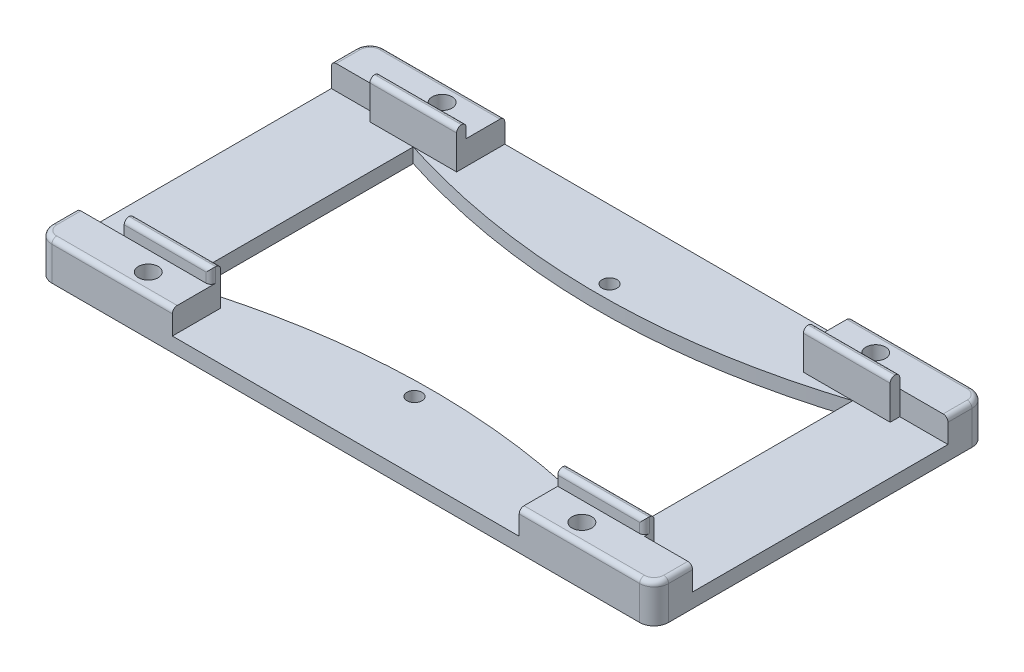
from build123d import *

# Parameters (mm, degrees)
SKETCH1_W                      = 128
SKETCH1_H                      = 69
BOSS_EXTRUDE1_DEPTH            = 3
SKETCH5_R                      = 1.55
CUT_EXTRUDE5_DEPTH             = 10
SKETCH7_W                      = 28
SKETCH7_H                      = 8
BOSS_EXTRUDE2_DEPTH            = 5
SKETCH2_R                      = 2.05
CUT_EXTRUDE6_DEPTH             = 73.878323252
CUT_EXTRUDE6_DIRECTION_2_REACH = 74.878
CUT_EXTRUDE7_DEPTH             = 3
SKETCH8_W                      = 18
SKETCH8_H                      = 2
BOSS_EXTRUDE3_DEPTH            = 8
FILLET1_R                      = 3
FILLET2_R                      = 1


with BuildPart() as part:
    # Sketch1 → Boss-Extrude1 (new body)
    with BuildSketch(Plane(origin=(0, 0, 0), x_dir=(1, 0, 0), z_dir=(0, 1, 0))):
        Rectangle(SKETCH1_W, SKETCH1_H)
    extrude(amount=BOSS_EXTRUDE1_DEPTH)

    # Sketch5 → Cut-Extrude5 (cut)
    with BuildSketch(Plane(origin=(0, 3, 0), x_dir=(1, 0, 0), z_dir=(0, 1, 0))):
        with Locations(Location((0, -20.25, 0), (0, 0, 270))):
            Circle(SKETCH5_R)
        with Locations(Location((0, 20.25, 0), (0, 0, 270))):
            Circle(SKETCH5_R)
    extrude(amount=-CUT_EXTRUDE5_DEPTH, mode=Mode.SUBTRACT)

    # Sketch7 → Boss-Extrude2 (add)
    with BuildSketch(Plane(origin=(0, 3, 0), x_dir=(1, 0, 0), z_dir=(0, 1, 0))):
        with Locations((-50, 30.5)):
            Rectangle(SKETCH7_W, SKETCH7_H)
        with Locations((50, 30.5)):
            Rectangle(SKETCH7_W, SKETCH7_H)
        with Locations((50, -30.5)):
            Rectangle(SKETCH7_W, SKETCH7_H)
        with Locations((-50, -30.5)):
            Rectangle(SKETCH7_W, SKETCH7_H)
    extrude(amount=BOSS_EXTRUDE2_DEPTH)

    # Sketch2 → Cut-Extrude6 (cut)
    with BuildSketch(Plane(origin=(0, 3, 0), x_dir=(1, 0, 0), z_dir=(0, 1, 0))):
        with Locations(Location((-45, 30.5, 0), (0, 0, 270))):
            Circle(SKETCH2_R)
        with Locations(Location((45, 30.5, 0), (0, 0, 270))):
            Circle(SKETCH2_R)
        with Locations(Location((45, -30.5, 0), (0, 0, 270))):
            Circle(SKETCH2_R)
        with Locations(Location((-45, -30.5, 0), (0, 0, 270))):
            Circle(SKETCH2_R)
    extrude(amount=-CUT_EXTRUDE6_DEPTH, mode=Mode.SUBTRACT)

    # Sketch2 → Cut-Extrude6 direction 2 (cut, up to next)
    with BuildSketch(Plane(origin=(0, 3, 0), x_dir=(1, 0, 0), z_dir=(0, 1, 0)), mode=Mode.PRIVATE) as cut_extrude6_direction_2_sk1:
        with Locations(Location((-45, 30.5, 0), (0, 0, 270))):
            Circle(SKETCH2_R)
    cut_extrude6_direction_2_tool1 = extrude(cut_extrude6_direction_2_sk1.sketch, amount=CUT_EXTRUDE6_DIRECTION_2_REACH, mode=Mode.PRIVATE) & part.part
    # Sketch2 → Cut-Extrude6 direction 2 (cut, up to next)
    with BuildSketch(Plane(origin=(0, 3, 0), x_dir=(1, 0, 0), z_dir=(0, 1, 0)), mode=Mode.PRIVATE) as cut_extrude6_direction_2_sk2:
        with Locations(Location((45, 30.5, 0), (0, 0, 270))):
            Circle(SKETCH2_R)
    cut_extrude6_direction_2_tool2 = extrude(cut_extrude6_direction_2_sk2.sketch, amount=CUT_EXTRUDE6_DIRECTION_2_REACH, mode=Mode.PRIVATE) & part.part
    # Sketch2 → Cut-Extrude6 direction 2 (cut, up to next)
    with BuildSketch(Plane(origin=(0, 3, 0), x_dir=(1, 0, 0), z_dir=(0, 1, 0)), mode=Mode.PRIVATE) as cut_extrude6_direction_2_sk3:
        with Locations(Location((45, -30.5, 0), (0, 0, 270))):
            Circle(SKETCH2_R)
    cut_extrude6_direction_2_tool3 = extrude(cut_extrude6_direction_2_sk3.sketch, amount=CUT_EXTRUDE6_DIRECTION_2_REACH, mode=Mode.PRIVATE) & part.part
    # Sketch2 → Cut-Extrude6 direction 2 (cut, up to next)
    with BuildSketch(Plane(origin=(0, 3, 0), x_dir=(1, 0, 0), z_dir=(0, 1, 0)), mode=Mode.PRIVATE) as cut_extrude6_direction_2_sk4:
        with Locations(Location((-45, -30.5, 0), (0, 0, 270))):
            Circle(SKETCH2_R)
    cut_extrude6_direction_2_tool4 = extrude(cut_extrude6_direction_2_sk4.sketch, amount=CUT_EXTRUDE6_DIRECTION_2_REACH, mode=Mode.PRIVATE) & part.part
    add(cut_extrude6_direction_2_tool1.solids().sort_by_distance((-45, 3, -30.5))[0], mode=Mode.SUBTRACT)
    add(cut_extrude6_direction_2_tool2.solids().sort_by_distance((45, 3, -30.5))[0], mode=Mode.SUBTRACT)
    add(cut_extrude6_direction_2_tool3.solids().sort_by_distance((45, 3, 30.5))[0], mode=Mode.SUBTRACT)
    add(cut_extrude6_direction_2_tool4.solids().sort_by_distance((-45, 3, 30.5))[0], mode=Mode.SUBTRACT)

    # Sketch6 → Cut-Extrude7 (cut)
    with BuildSketch(Plane(origin=(0, 3, 0), x_dir=(1, 0, 0), z_dir=(0, 1, 0))):
        with BuildLine():
            Line((-45, 24.5), (-45, -24.5))
            add(Edge.make_bspline(
                [(-45, -24.5), (0.589986909, -9.997447075), (46.241142194, -24.5)],
                knots=[0, 0, 0, 1, 1, 1], degree=2))
            Line((46.241142194, -24.5), (46.241142194, 24.5))
            add(Edge.make_bspline(
                [(-45, 24.5), (0.589986909, 9.997447075), (46.241142194, 24.5)],
                knots=[0, 0, 0, 1, 1, 1], degree=2))
        make_face()
    extrude(amount=-CUT_EXTRUDE7_DEPTH, mode=Mode.SUBTRACT)

    # Sketch8 → Boss-Extrude3 (add)
    with BuildSketch(Plane(origin=(0, 3, 0), x_dir=(1, 0, 0), z_dir=(0, 1, 0))):
        with Locations((-45, 25.5)):
            Rectangle(SKETCH8_W, SKETCH8_H)
        with Locations((-45, -25.5)):
            Rectangle(SKETCH8_W, SKETCH8_H)
        with Locations((45, -25.5)):
            Rectangle(SKETCH8_W, SKETCH8_H)
        with Locations((45, 25.5)):
            Rectangle(SKETCH8_W, SKETCH8_H)
    extrude(amount=BOSS_EXTRUDE3_DEPTH)

    # Fillet1
    fillet1_edges = [part.edges().sort_by_distance(p)[0] for p in [
        (64, 4, 34.5),
        (-64, 4, 34.5),
        (-64, 4, -34.5),
        (64, 4, -34.5),
    ]]
    fillet(fillet1_edges, radius=FILLET1_R)

    # Fillet2
    fillet2_edges = [part.edges().sort_by_distance(p)[0] for p in [
        (64, 8, -29),
        (63.121320344, 8, -33.621320344),
        (48.5, 8, -34.5),
        (36, 5.5, -34.5),
        (45, 11, -24.5),
        (45, 11, -26.5),
        (45, 11, 26.5),
        (45, 11, 24.5),
        (-45, 11, 26.5),
        (-45, 11, 24.5),
        (-45, 11, -24.5),
        (-45, 11, -26.5),
        (-64, 8, -29),
        (-63.121320344, 8, -33.621320344),
        (-64, 8, 29),
        (-63.121320344, 8, 33.621320344),
        (48.5, 8, 34.5),
        (63.121320344, 8, 33.621320344),
        (-48.5, 8, -34.5),
        (-48.5, 8, 34.5),
        (-36, 9.5, 26.5),
        (54, 9.5, 26.5),
        (64, 8, 29),
    ]]
    fillet(fillet2_edges, radius=FILLET2_R - 0.0001)  # a hair under: the kernel refuses the full size


solid = part.part
